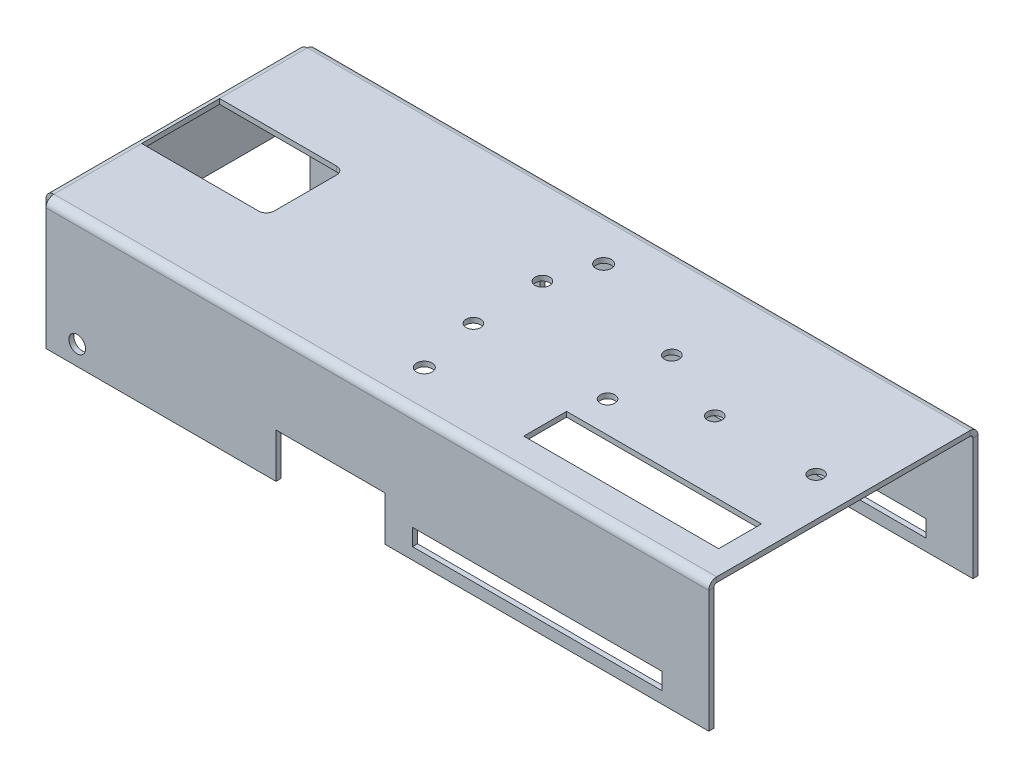
from build123d import *

# Parameters (mm, degrees)
SKETCH1_W          = 170
SKETCH1_H          = 65
BASE_FLANGE1_DEPTH = 1.29
EDGE_FLANGE1_DEPTH = 170
EDGE_FLANGE3_DEPTH = 65
CUT_EXTRUDE1_REACH = 187.022
SKETCH16_R         = 2
SKETCH16_W         = 50
SKETCH16_H         = 11
EDGE_FLANGE7_DEPTH = 170
SKETCH34_R         = 2.15
SKETCH34_W         = 28
SKETCH34_H         = 11.41
SKETCH34_W_2       = 64
SKETCH34_H_2       = 4.3
CUT_EXTRUDE5_DEPTH = 187.484767556
SKETCH36_R         = 1.875
CUT_EXTRUDE6_DEPTH = 10
SKETCH37_R         = 1.875
CUT_EXTRUDE7_DEPTH = 10


# Sheet-metal steps are written as plain solids
with BuildPart() as part:
    # Sketch1 → Base-Flange1 (new body)
    with BuildSketch(Plane(origin=(0, 0, 0), x_dir=(1, 0, 0), z_dir=(0, 1, 0))):
        with Locations((85, 32.5)):
            Rectangle(SKETCH1_W, SKETCH1_H)
    extrude(amount=-BASE_FLANGE1_DEPTH)

    # Edge-Flange1 section (across the edge) → Edge-Flange1 (add)
    with BuildSketch(Plane(origin=(170, -1.29, 0.7366), x_dir=(0, 0, -1), z_dir=(-1, 0, 0))):
        with BuildLine():
            Line((-1.29, 0.7366), (-1.29, 32))
            Line((-1.29, 32), (0, 32))
            Line((0, 32), (0, 0.7366))
            ThreePointArc((0, 0.7366), (0.215745145, 0.215745145), (0.7366, 0))
            Line((0.7366, 0), (0.7366, -1.29))
            ThreePointArc((0.7366, -1.29), (-0.696422603, -0.696422603), (-1.29, 0.7366))
        make_face()
    extrude(amount=EDGE_FLANGE1_DEPTH)

    # Edge-Flange3 section (across the edge) → Edge-Flange3 (add)
    with BuildSketch(Plane(origin=(-0.7366, -1.29, 0), x_dir=(1, 0, 0), z_dir=(0, 0, -1))):
        with BuildLine():
            Line((-1.29, 0.7366), (-1.29, 15))
            Line((-1.29, 15), (0, 15))
            Line((0, 15), (0, 0.7366))
            ThreePointArc((0, 0.7366), (0.215745145, 0.215745145), (0.7366, 0))
            Line((0.7366, 0), (0.7366, -1.29))
            ThreePointArc((0.7366, -1.29), (-0.696422603, -0.696422603), (-1.29, 0.7366))
        make_face()
    extrude(amount=EDGE_FLANGE3_DEPTH)

    # Sketch16 → Cut-Extrude1 (cut, up to next)
    with BuildSketch(Plane(origin=(0, 0, 0), x_dir=(1, 0, 0), z_dir=(0, 1, 0)), mode=Mode.PRIVATE) as cut_extrude1_sk1:
        with Locations(Location((86, 9, 0), (0, 0, 90))):
            Circle(SKETCH16_R)
    cut_extrude1_tool1 = extrude(cut_extrude1_sk1.sketch, amount=-CUT_EXTRUDE1_REACH, mode=Mode.PRIVATE) & part.part
    # Sketch16 → Cut-Extrude1 (cut, up to next)
    with BuildSketch(Plane(origin=(0, 0, 0), x_dir=(1, 0, 0), z_dir=(0, 1, 0)), mode=Mode.PRIVATE) as cut_extrude1_sk2:
        with Locations(Location((86, 55, 0), (0, 0, 90))):
            Circle(SKETCH16_R)
    cut_extrude1_tool2 = extrude(cut_extrude1_sk2.sketch, amount=-CUT_EXTRUDE1_REACH, mode=Mode.PRIVATE) & part.part
    # Sketch16 → Cut-Extrude1 (cut, up to next)
    with BuildSketch(Plane(origin=(0, 0, 0), x_dir=(1, 0, 0), z_dir=(0, 1, 0)), mode=Mode.PRIVATE) as cut_extrude1_sk3:
        with Locations((139, 12)):
            Rectangle(SKETCH16_W, SKETCH16_H)
    cut_extrude1_tool3 = extrude(cut_extrude1_sk3.sketch, amount=-CUT_EXTRUDE1_REACH, mode=Mode.PRIVATE) & part.part
    # Sketch16 → Cut-Extrude1 (cut, up to next)
    with BuildSketch(Plane(origin=(0, 0, 0), x_dir=(1, 0, 0), z_dir=(0, 1, 0)), mode=Mode.PRIVATE) as cut_extrude1_sk4:
        with BuildLine():
            Line((30, 42.5), (0, 42.5))
            Line((0, 42.5), (0, 22.5))
            Line((0, 22.5), (30, 22.5))
            ThreePointArc((30, 22.5), (31.414213562, 23.085786438), (32, 24.5))
            Line((32, 24.5), (32, 40.5))
            ThreePointArc((32, 40.5), (31.414213562, 41.914213562), (30, 42.5))
        make_face()
    cut_extrude1_tool4 = extrude(cut_extrude1_sk4.sketch, amount=-CUT_EXTRUDE1_REACH, mode=Mode.PRIVATE) & part.part
    add(cut_extrude1_tool1.solids().sort_by_distance((86, 0, -9))[0], mode=Mode.SUBTRACT)
    add(cut_extrude1_tool2.solids().sort_by_distance((86, 0, -55))[0], mode=Mode.SUBTRACT)
    add(cut_extrude1_tool3.solids().sort_by_distance((139, 0, -12))[0], mode=Mode.SUBTRACT)
    add(cut_extrude1_tool4.solids().sort_by_distance((15.958166, 0, -32.5))[0], mode=Mode.SUBTRACT)

    # Edge-Flange7 section (across the edge) → Edge-Flange7 (add)
    with BuildSketch(Plane(origin=(0, -1.29, -65.7366), x_dir=(0, 0, 1), z_dir=(1, 0, 0))):
        with BuildLine():
            Line((-1.29, 0.7366), (-1.29, 32))
            Line((-1.29, 32), (0, 32))
            Line((0, 32), (0, 0.7366))
            ThreePointArc((0, 0.7366), (0.215745145, 0.215745145), (0.7366, 0))
            Line((0.7366, 0), (0.7366, -1.29))
            ThreePointArc((0.7366, -1.29), (-0.696422603, -0.696422603), (-1.29, 0.7366))
        make_face()
    extrude(amount=EDGE_FLANGE7_DEPTH)

    # Sketch34 → Cut-Extrude5 (cut, through all)
    with BuildSketch(Plane(origin=(0, 0, -67.0266), x_dir=(-1, 0, 0), z_dir=(0, 0, -1))):
        with Locations(Location((-8, -28.29, 0), (0, 0, 270))):
            Circle(SKETCH34_R)
        with Locations((-73, -27.585)):
            Rectangle(SKETCH34_W, SKETCH34_H)
        with Locations((-126, -28.14)):
            Rectangle(SKETCH34_W_2, SKETCH34_H_2)
    extrude(amount=-CUT_EXTRUDE5_DEPTH, mode=Mode.SUBTRACT)

    # Sketch36 → Cut-Extrude6 (cut)
    with BuildSketch(Plane(origin=(0, 0, 0), x_dir=(1, 0, 0), z_dir=(0, 1, 0))):
        with Locations(Location((116.5, 25.5, 0), (0, 0, 270))):
            Circle(SKETCH36_R)
        with Locations(Location((115, 43.5, 0), (0, 0, 270))):
            Circle(SKETCH36_R)
        with Locations(Location((82.5, 25.1, 0), (0, 0, 270))):
            Circle(SKETCH36_R)
        with Locations(Location((82, 43.3, 0), (0, 0, 270))):
            Circle(SKETCH36_R)
    extrude(amount=-CUT_EXTRUDE6_DEPTH, mode=Mode.SUBTRACT)

    # Sketch37 → Cut-Extrude7 (cut)
    with BuildSketch(Plane(origin=(0, 0, 0), x_dir=(1, 0, 0), z_dir=(0, 1, 0))):
        with Locations(Location((160, 35.5, 0), (0, 0, 270))):
            Circle(SKETCH37_R)
        with Locations(Location((134, 35.5, 0), (0, 0, 270))):
            Circle(SKETCH37_R)
    extrude(amount=-CUT_EXTRUDE7_DEPTH, mode=Mode.SUBTRACT)


solid = part.part
